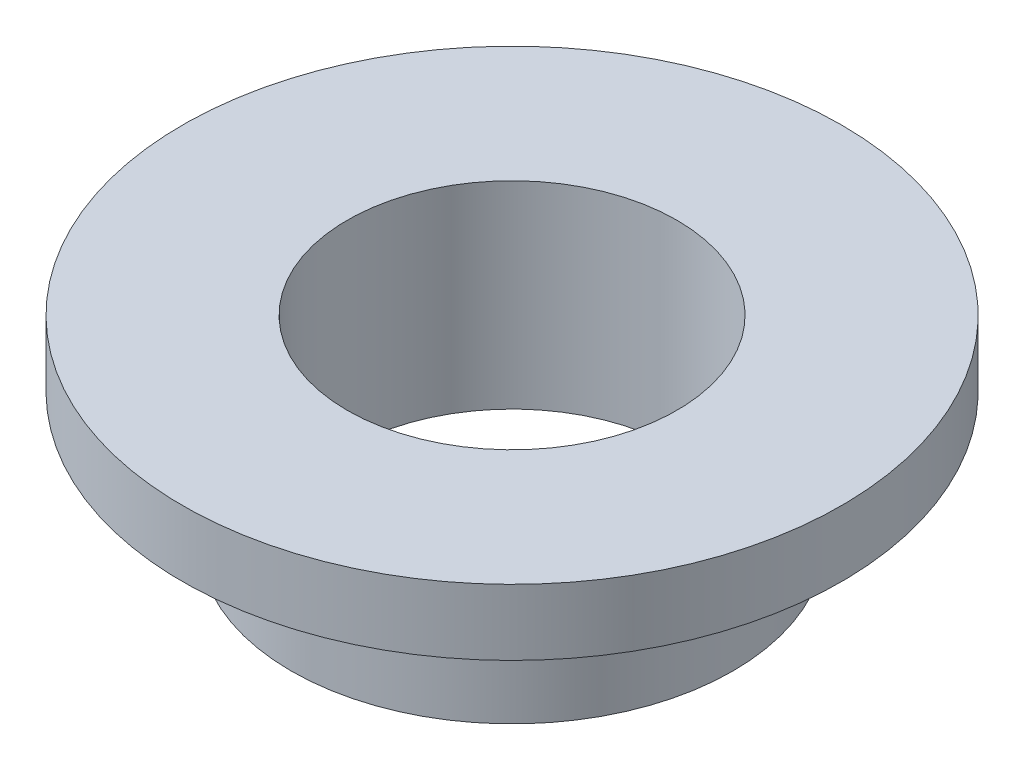
from build123d import *


with BuildPart() as part:
    # Эскиз1 → Повернуть1 (revolve)
    with BuildSketch(Plane.XY):
        Polygon((5, -0.353980743), (5, 5.646019257), (10, 5.646019257), (10, 3.646019257), (6.7, 3.646019257), (6.7, -0.353980743), align=None)
    revolve(axis=Axis((0, 0, 0), (0, 1, 0)))


solid = part.part
